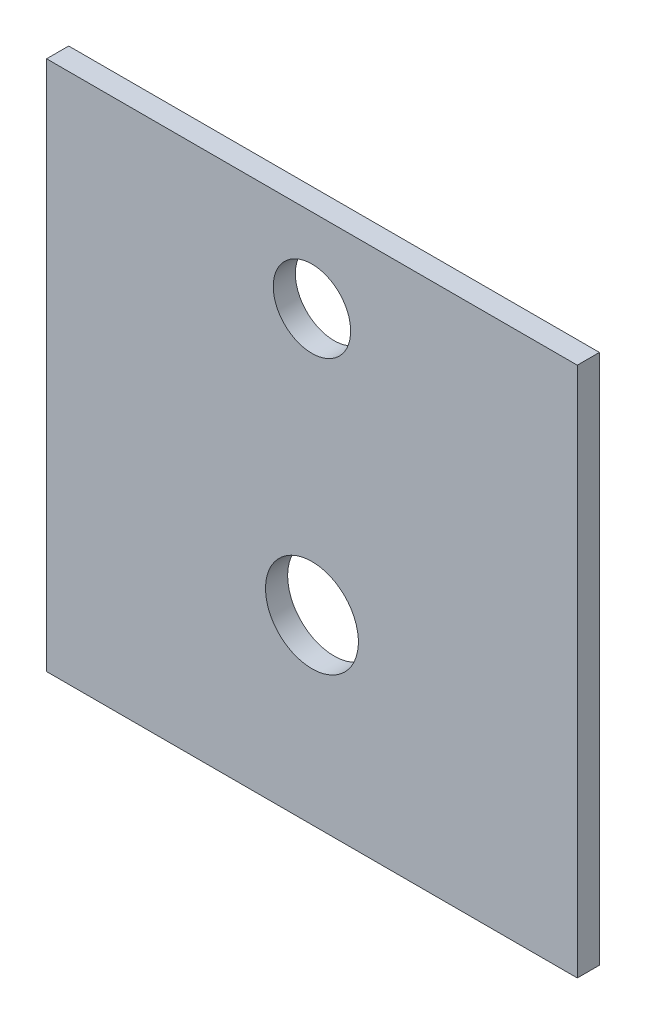
from build123d import *

# Parameters (mm, degrees)
SKETCH1_W          = 24
SKETCH1_H          = 24
BASE_FLANGE1_DEPTH = 1
SKETCH4_R          = 1.75
SKETCH4_R_2        = 2.1
CUT_EXTRUDE1_DEPTH = 10


# Sheet-metal steps are written as plain solids
with BuildPart() as part:
    # Sketch1 → Base-Flange1 (new body)
    with BuildSketch(Plane.XY):
        with Locations((12, 12)):
            Rectangle(SKETCH1_W, SKETCH1_H)
    extrude(amount=-BASE_FLANGE1_DEPTH)

    # Sketch4 → Cut-Extrude1 (cut)
    with BuildSketch(Plane(origin=(0, 0, -1), x_dir=(-1, 0, 0), z_dir=(0, 0, -1))):
        with Locations((-12, 20.210812599)):
            Circle(SKETCH4_R)
        with Locations((-12, 8.210812599)):
            Circle(SKETCH4_R_2)
    extrude(amount=-CUT_EXTRUDE1_DEPTH, mode=Mode.SUBTRACT)


solid = part.part
